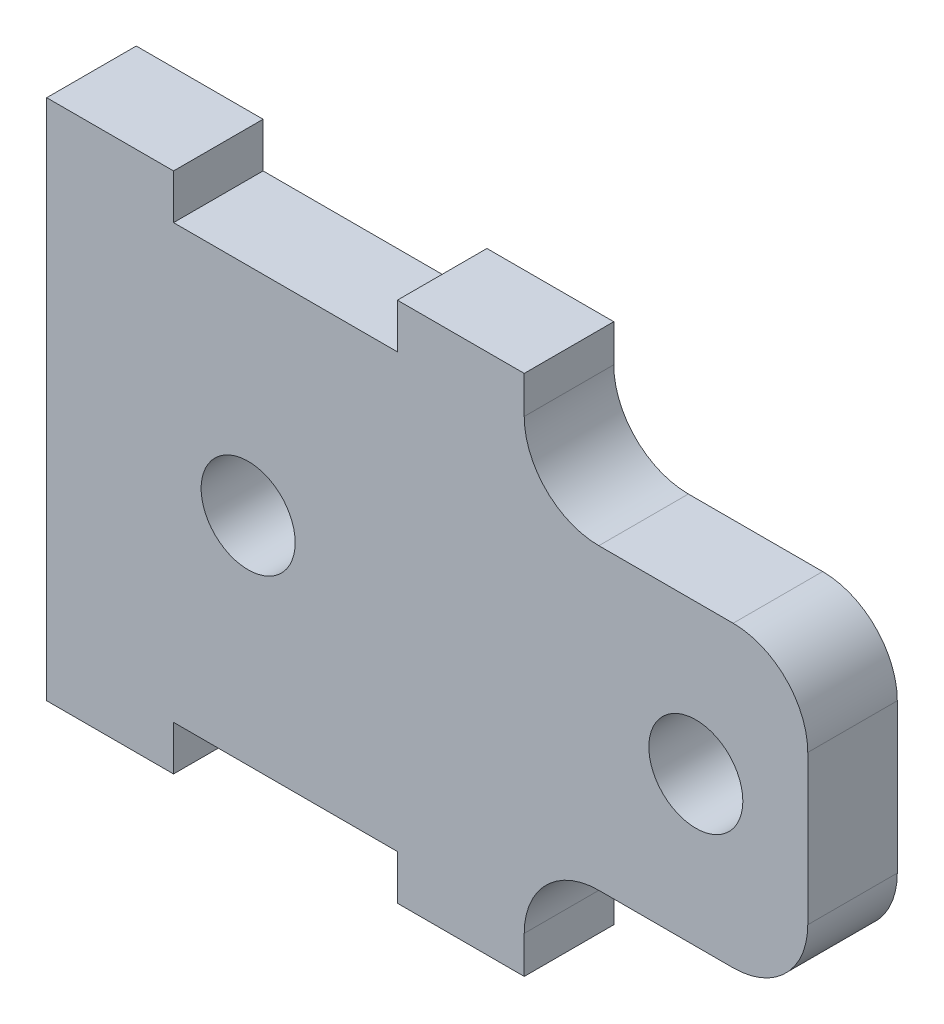
from build123d import *

# Parameters (mm, degrees)
ESBO_O1_R                = 3.15
RESSALTO_EXTRUS_O1_DEPTH = 6
FILETE1_R                = 5


with BuildPart() as part:
    # Esboço1 → Ressalto-extrusão1 (new body)
    with BuildSketch(Plane.XY):
        Polygon((-28.5, 17.5), (-28.5, -17.5), (-20, -17.5), (-20, -14.5), (-5, -14.5), (-5, -17.5), (3.5, -17.5), (3.5, -10), (22.5, -10), (22.5, 10), (3.5, 10), (3.5, 17.5), (-5, 17.5), (-5, 14.5), (-20, 14.5), (-20, 17.5), align=None)
        with Locations((-15, 0)):
            Circle(ESBO_O1_R, mode=Mode.SUBTRACT)
        with Locations((15, 0)):
            Circle(ESBO_O1_R, mode=Mode.SUBTRACT)
    extrude(amount=RESSALTO_EXTRUS_O1_DEPTH)

    # Filete1
    filete1_edges = [part.edges().sort_by_distance(p)[0] for p in [
        (3.5, -10, 3),
        (22.5, -10, 3),
        (22.5, 10, 3),
        (3.5, 10, 3),
    ]]
    fillet(filete1_edges, radius=FILETE1_R)


solid = part.part
